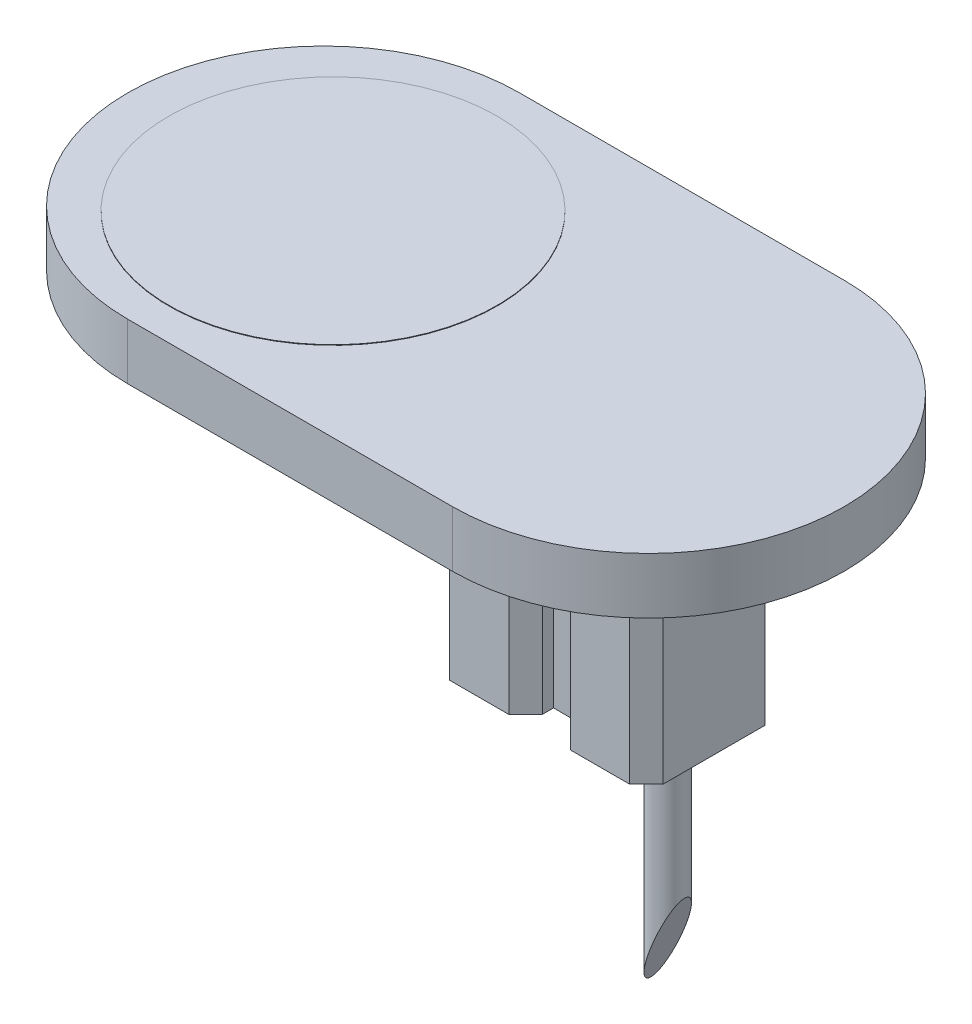
from build123d import *

# Parameters (mm, degrees)
EXTRUDE_1_DEPTH     = 1
SKETCH_2_R          = 2.930453947
EXTRUDE_2_DEPTH     = 0.01
SKETCH_3_W          = 3.813800337
SKETCH_3_H          = 2.421486406
EXTRUDE_3_DEPTH     = 4
SKETCH_4_W          = 0.5
SKETCH_4_H          = 4
CUT_EXTRUDE_1_DEPTH = 0.3
SKETCH_5_W          = 0.5
SKETCH_5_H          = 4
CUT_EXTRUDE_2_DEPTH = 0.5
CHAMFER_1_SIZE      = 0.3
SKETCH_6_R          = 0.3
EXTRUDE_4_DEPTH     = 4
CUT_EXTRUDE_3_DEPTH = 2


with BuildPart() as part:
    # 草图1 → 凸台-拉伸1 (new body)
    with BuildSketch(Plane(origin=(0, 0, 0), x_dir=(1, 0, 0), z_dir=(0, 1, 0))):
        with BuildLine():
            Line((-8.818862275, 3.5), (-3.018862275, 3.5))
            ThreePointArc((-3.018862275, 3.5), (0.481137725, 0), (-3.018862275, -3.5))
            Line((-3.018862275, -3.5), (-8.818862275, -3.5))
            ThreePointArc((-8.818862275, -3.5), (-12.318862275, 0), (-8.818862275, 3.5))
        make_face()
    extrude(amount=EXTRUDE_1_DEPTH)

    # 草图2 → 凸台-拉伸2 (add)
    with BuildSketch(Plane(origin=(0, 1, 0), x_dir=(1, 0, 0), z_dir=(0, 1, 0))):
        with Locations(Location((-8.651499717, 0, 0), (0, 0, 90))):
            Circle(SKETCH_2_R)
    extrude(amount=EXTRUDE_2_DEPTH)

    # 草图3 → 凸台-拉伸3 (add)
    with BuildSketch(Plane(origin=(0, 0, 0), x_dir=(-1, 0, 0), z_dir=(0, -1, 0))):
        with Locations((3.751479011, 0)):
            Rectangle(SKETCH_3_W, SKETCH_3_H)
    extrude(amount=EXTRUDE_3_DEPTH)

    # 草图4 → 切除-拉伸1 (cut)
    with BuildSketch(Plane(origin=(0, 0, -1.210743203), x_dir=(-1, 0, 0), z_dir=(0, 0, -1))):
        with Locations((3.751479011, -2)):
            Rectangle(SKETCH_4_W, SKETCH_4_H)
    extrude(amount=-CUT_EXTRUDE_1_DEPTH, mode=Mode.SUBTRACT)

    # 草图5 → 切除-拉伸2 (cut)
    with BuildSketch(Plane.XY.offset(1.210743203)):
        with Locations((-3.751479011, -2)):
            Rectangle(SKETCH_5_W, SKETCH_5_H)
    extrude(amount=-CUT_EXTRUDE_2_DEPTH, mode=Mode.SUBTRACT)

    # 倒角1
    chamfer_1_edges = [part.edges().sort_by_distance(p)[0] for p in [
        (-5.658379179, -2, 1.210743203),
        (-5.658379179, -2, -1.210743203),
        (-1.844578842, -2, -1.210743203),
        (-1.844578842, -2, 1.210743203),
        (-4.001479011, -2, -1.210743203),
        (-3.501479011, -2, -1.210743203),
        (-3.501479011, -2, 1.210743203),
        (-4.001479011, -2, 1.210743203),
    ]]
    chamfer(chamfer_1_edges, length=CHAMFER_1_SIZE - 0.0001)  # a hair under: the kernel refuses the full size

    # 草图6 → 凸台-拉伸4 (add)
    with BuildSketch(Plane(origin=(0, -4, 0), x_dir=(-1, 0, 0), z_dir=(0, -1, 0))):
        with Locations(Location((2.673028926, 0, 0), (0, 0, 90))):
            Circle(SKETCH_6_R)
    extrude(amount=EXTRUDE_4_DEPTH)

    # 草图7 → 切除-拉伸3 (cut, symmetric)
    with BuildSketch(Plane.XY):
        Polygon((-2.973028926, -8), (-2.373028926, -6.485168842), (-2.373028926, -8), align=None)
    extrude(amount=CUT_EXTRUDE_3_DEPTH, both=True, mode=Mode.SUBTRACT)


solid = part.part
